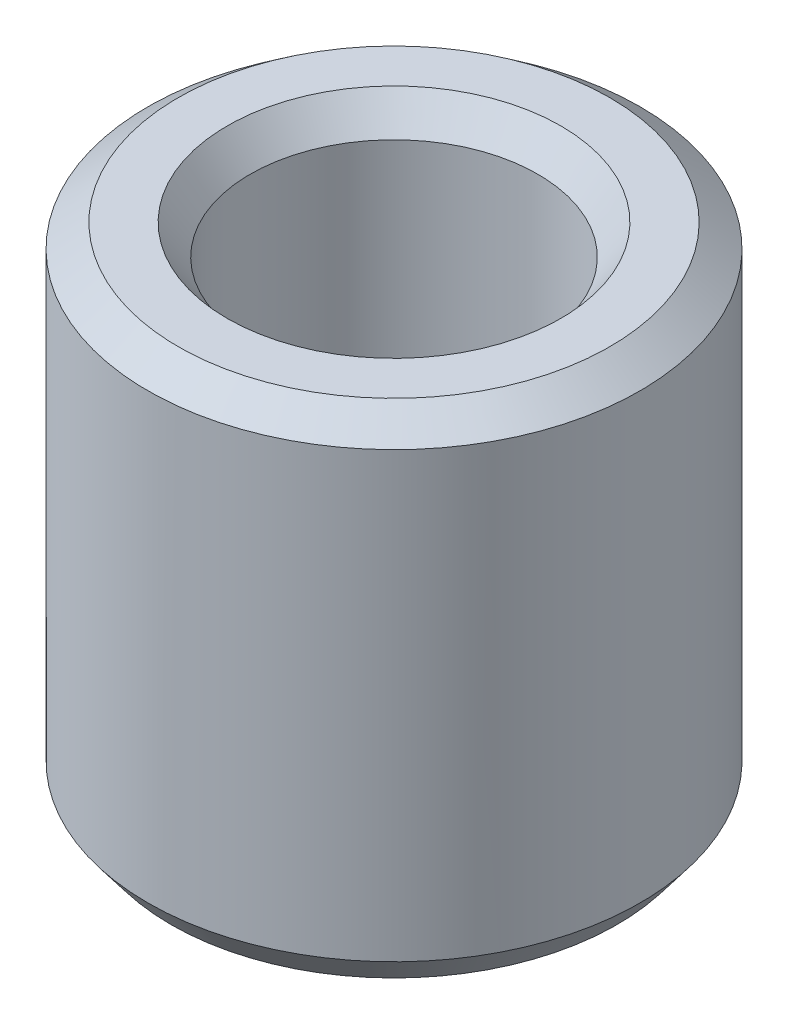
from build123d import *
from OCP.BRepFilletAPI import BRepFilletAPI_MakeChamfer

# Parameters (mm, degrees)
SKETCH1_R           = 20
BOSS_EXTRUDE1_DEPTH = 40.382901005
SKETCH2_R           = 11.686616587
CUT_EXTRUDE1_DEPTH  = 50.30292784
CHAMFER1_SIZE       = 1.871479389
CHAMFER1_SIZE2      = 2.463174159


with BuildPart() as part:
    # Sketch1 → Boss-Extrude1 (new body)
    with BuildSketch(Plane(origin=(0, 0, 0), x_dir=(1, 0, 0), z_dir=(0, 1, 0))):
        Circle(SKETCH1_R)
    extrude(amount=BOSS_EXTRUDE1_DEPTH)

    # Sketch2 → Cut-Extrude1 (cut, through all)
    with BuildSketch(Plane(origin=(0, 0, 0), x_dir=(1, 0, 0), z_dir=(0, 1, 0))):
        Circle(SKETCH2_R)
    extrude(amount=CUT_EXTRUDE1_DEPTH, mode=Mode.SUBTRACT)

    # Chamfer1: one chamfer whose edges measure the first distance from different faces: ONE call of the kernel's chamfer builder (chamfer() names one face for all edges)
    chamfer1_edges_1 = [part.edges().sort_by_distance(p)[0] for p in [
        (-11.686616587, 40.382901005, 0),
    ]]
    chamfer1_side_1 = [part.faces().sort_by_distance(p)[0] for p in [
        (-19.434314575, 40.382901005, 0),
    ]]
    chamfer1_edges_2 = [part.edges().sort_by_distance(p)[0] for p in [
        (-11.686616587, 0, 0),
    ]]
    chamfer1_side_2 = [part.faces().sort_by_distance(p)[0] for p in [
        (-11.686616587, 20.191450503, 0),
    ]]
    chamfer1_edges_3 = [part.edges().sort_by_distance(p)[0] for p in [
        (-20, 0, 0),
    ]]
    chamfer1_side_3 = [part.faces().sort_by_distance(p)[0] for p in [
        (-19.434314575, 0, 0),
    ]]
    chamfer1_edges_4 = [part.edges().sort_by_distance(p)[0] for p in [
        (-20, 40.382901005, 0),
    ]]
    chamfer1_side_4 = [part.faces().sort_by_distance(p)[0] for p in [
        (-20, 20.191450503, 0),
    ]]
    chamfer1 = BRepFilletAPI_MakeChamfer(part.part.solid().wrapped)
    for e in chamfer1_edges_1:
        chamfer1.Add(CHAMFER1_SIZE, CHAMFER1_SIZE2, e.wrapped, chamfer1_side_1[0].wrapped)  # the first distance lies on this face
    for e in chamfer1_edges_2:
        chamfer1.Add(CHAMFER1_SIZE, CHAMFER1_SIZE2, e.wrapped, chamfer1_side_2[0].wrapped)  # the first distance lies on this face
    for e in chamfer1_edges_3:
        chamfer1.Add(CHAMFER1_SIZE, CHAMFER1_SIZE2, e.wrapped, chamfer1_side_3[0].wrapped)  # the first distance lies on this face
    for e in chamfer1_edges_4:
        chamfer1.Add(CHAMFER1_SIZE, CHAMFER1_SIZE2, e.wrapped, chamfer1_side_4[0].wrapped)  # the first distance lies on this face
    add(Compound.cast(chamfer1.Shape()), mode=Mode.REPLACE)


solid = part.part
